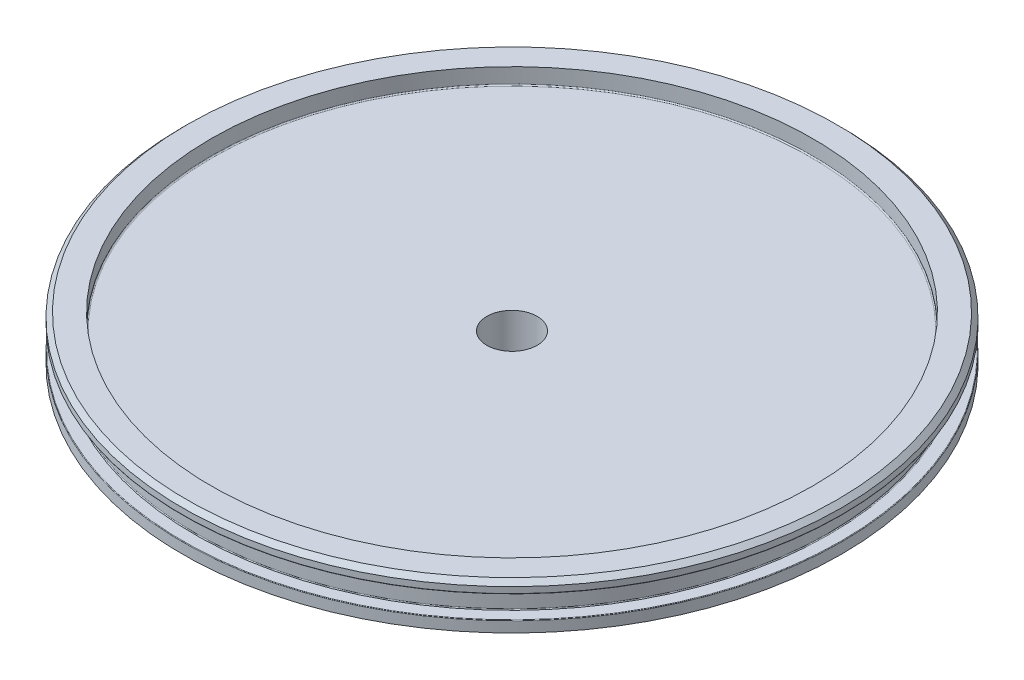
from build123d import *

# Parameters (mm, degrees)
SKETCH6_R                        = 66.04
BOSS_EXTRUDE1_DEPTH              = 2.54
PIPE_TAP_DRILL_FOR_1_4_TAP_GN2_D = 11.1252
CNC_ID_FILLET_R                  = 0.1778
CNC_OD_FILLET_R                  = 0.127
CNC_CHAMFERS_SIZE                = 1.016
CNC_BORE_FILLET_R                = 0.254


with BuildPart() as part:
    # Sketch1 → Revolve1 (revolve)
    with BuildSketch(Plane.XY):
        Polygon((0, 0), (72.898, 0), (72.898, 2.4638), (70.0532, 2.4638), (70.0532, 7.4422), (72.898, 7.4422), (72.898, 9.906), (66.548, 9.906), (66.548, 6.35), (0, 6.35), align=None)
    revolve(axis=Axis((0, 48.192213231, 0), (0, -1, 0)))

    # Sketch6 → Boss-Extrude1 (add)
    with BuildSketch(Plane.XZ):
        Circle(SKETCH6_R)
    extrude(amount=BOSS_EXTRUDE1_DEPTH)

    # Pipe Tap Drill for 1/4 Tap - GN2 (through all)
    with Locations(Plane(origin=(0, 6.35, 0), x_dir=(1, 0, 0), z_dir=(0, 1, 0))):
        with Locations((0, 0)):
            Hole(PIPE_TAP_DRILL_FOR_1_4_TAP_GN2_D / 2)

    # CNC ID Fillet
    cnc_id_fillet_edges = [part.edges().sort_by_distance(p)[0] for p in [
        (-70.0532, 7.4422, 0),
        (-70.0532, 2.4638, 0),
        (-66.04, 0, 0),
    ]]
    fillet(cnc_id_fillet_edges, radius=CNC_ID_FILLET_R)

    # CNC OD Fillet
    cnc_od_fillet_edges = [part.edges().sort_by_distance(p)[0] for p in [
        (-72.898, 7.4422, 0),
        (-72.898, 2.4638, 0),
        (-66.04, -2.54, 0),
    ]]
    fillet(cnc_od_fillet_edges, radius=CNC_OD_FILLET_R)

    # CNC Chamfers
    cnc_chamfers_edges = [part.edges().sort_by_distance(p)[0] for p in [
        (-72.898, 9.906, 0),
    ]]
    chamfer(cnc_chamfers_edges, length=CNC_CHAMFERS_SIZE)

    # CNC Bore Fillet
    cnc_bore_fillet_edges = [part.edges().sort_by_distance(p)[0] for p in [
        (-66.548, 6.35, 0),
    ]]
    fillet(cnc_bore_fillet_edges, radius=CNC_BORE_FILLET_R)


solid = part.part
